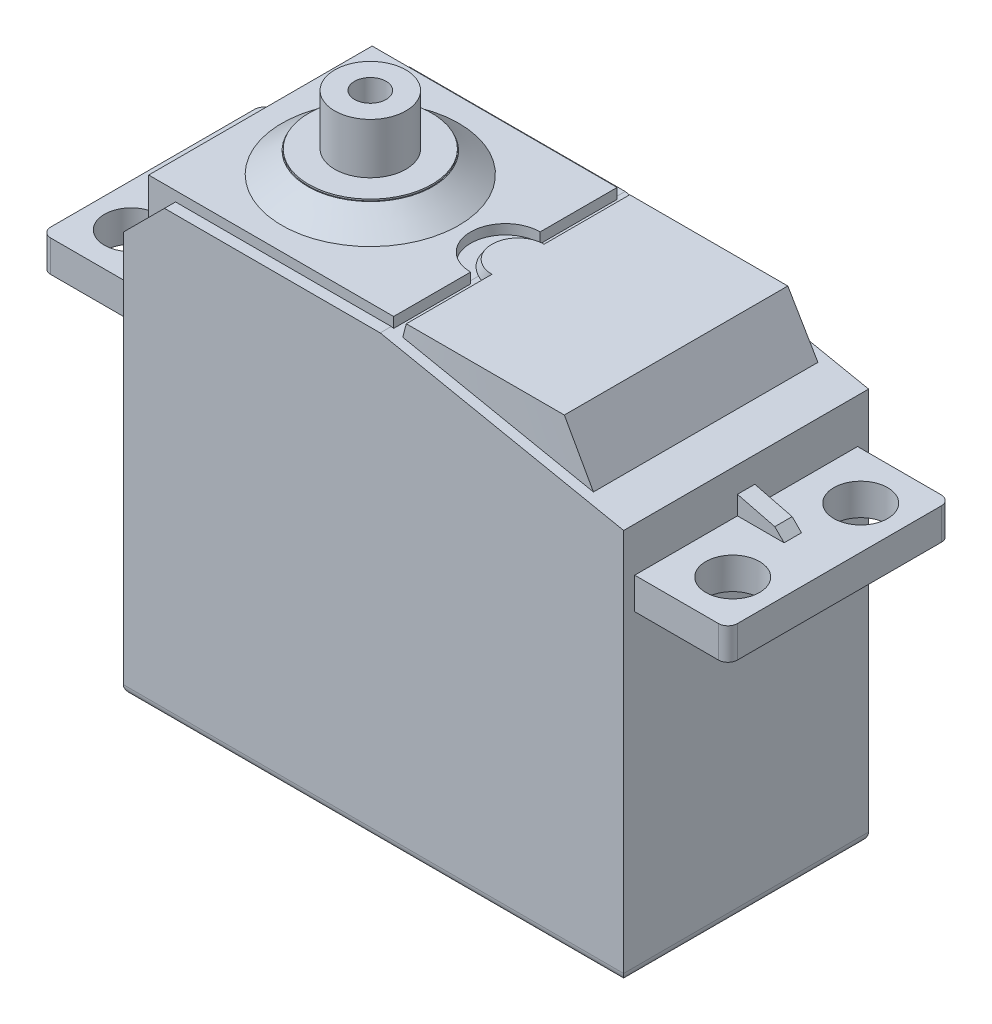
from build123d import *

# Parameters (mm, degrees)
EXTRUDE1_DEPTH     = 19.685
CHAMFER1_SIZE      = 3.302
FILLET1_R          = 0.762
SKETCH2_W          = 17.907
SKETCH2_H          = 2.54
EXTRUDE2_DEPTH     = 7.493
SKETCH4_W          = 17.907
SKETCH4_H          = 2.54
EXTRUDE3_DEPTH     = 7.493
FILLET2_R          = 0.762
EXTRUDE4_DEPTH     = 36.35375
SKETCH10_R         = 2.159
CUT_EXTRUDE1_DEPTH = 36.35375
SKETCH19_R         = 2.159
CUT_EXTRUDE2_DEPTH = 59.72110295
RIB2_START         = -0.6985
RIB2_DEPTH         = 1.397
RIB3_START         = -0.6985
RIB3_DEPTH         = 1.397
SKETCH16_R         = 5.0165
EXTRUDE5_DEPTH     = 1.651
SKETCH18_R         = 4.953
EXTRUDE6_DEPTH     = 0.127
SKETCH20_R         = 2.8575
SKETCH20_R_2       = 1.27
EXTRUDE7_DEPTH     = 4.064
SKETCH22_W         = 5.715
SKETCH22_H         = 3.175
EXTRUDE8_DEPTH     = 1.905
SKETCH24_R         = 0.635


with BuildPart() as part:
    # Sketch1 → Extrude1 (new body)
    with BuildSketch(Plane.XY):
        Polygon((0, 0), (40.2, 0), (40.2, 31.59125), (20.6375, 35.56), (0, 35.56), align=None)
    extrude(amount=EXTRUDE1_DEPTH)

    # Chamfer1
    chamfer1_edges = [part.edges().sort_by_distance(p)[0] for p in [
        (0, 35.56, 9.8425),
    ]]
    chamfer(chamfer1_edges, length=CHAMFER1_SIZE)

    # Fillet1
    fillet1_edges = [part.edges().sort_by_distance(p)[0] for p in [
        (20.1, 0, 0),
        (20.1, 0, 19.685),
        (40.2, 0, 9.8425),
        (0, 0, 9.8425),
    ]]
    fillet(fillet1_edges, radius=FILLET1_R)

    # Sketch2 → Extrude2 (add)
    with BuildSketch(Plane(origin=(40.2, 0, 0), x_dir=(0, 0, -1), z_dir=(1, 0, 0))):
        with Locations((-9.8425, 26.76525)):
            Rectangle(SKETCH2_W, SKETCH2_H)
    extrude(amount=EXTRUDE2_DEPTH)

    # Sketch4 → Extrude3 (add)
    with BuildSketch(Plane.ZY):
        with Locations((9.8425, 26.76652)):
            Rectangle(SKETCH4_W, SKETCH4_H)
    extrude(amount=EXTRUDE3_DEPTH)

    # Fillet2
    fillet2_edges = [part.edges().sort_by_distance(p)[0] for p in [
        (47.693, 26.76525, 18.796),
        (47.693, 26.76525, 0.889),
        (-7.493, 26.76652, 0.889),
        (-7.493, 26.76652, 18.796),
    ]]
    fillet(fillet2_edges, radius=FILLET2_R)

    # Sketch5 → Extrude4 (add)
    with BuildSketch(Plane(origin=(0, 0, 0), x_dir=(1, 0, 0), z_dir=(0, 1, 0))):
        with BuildLine():
            Line((1.143, -0.837535442), (20.828, -0.837535442))
            Line((20.828, -0.837535442), (20.828, -7.022435442))
            ThreePointArc((20.828, -7.022435442), (18.034, -9.816435442), (20.828, -12.610435442))
            Line((20.828, -12.610435442), (20.828, -18.795335442))
            Line((20.828, -18.795335442), (1.143, -18.795335442))
            Line((1.143, -18.795335442), (1.143, -0.837535442))
        make_face()
    extrude(amount=EXTRUDE4_DEPTH)

    # Loft1: read off the stored shape, not the designer's step
    # Loft1: loft between two sections, ruled curve by curve
    loft1_from = [
        Edge.make_bspline([(21.641638875, 35.356284925, 7.777844123), (20.350474841, 35.618230344, 7.645115734), (19.387970871, 35.813498721, 8.533256016), (19.387970871, 35.813498721, 11.181528503), (20.350474841, 35.618230344, 12.069668784), (21.641638875, 35.356284925, 11.936940395)], [0, 0, 0, 0, 0.5, 0.5, 1, 1, 1, 1], 3, [1, 0.609161307, 0.475443008, 0.475443008, 0.609161307, 1]),
        Edge.make_bspline([(21.641638875, 35.356284925, 18.877249077), (36.963924395, 32.247770131, 18.877249077)], [0, 0, 1, 1], 1),
        Edge.make_line((21.641638875, 35.356284925, 0.837535442), (36.963924395, 32.247770131, 0.837535442)),
        Edge.make_line((36.963924395, 32.247770131, 0.837535442), (36.963924395, 32.247770131, 18.877249077)),
        Edge.make_line((21.641638875, 35.356284925, 7.777844123), (21.641638875, 35.356284925, 0.837535442)),
        Edge.make_line((21.641638875, 35.356284925, 18.877249077), (21.641638875, 35.356284925, 11.936940395)),
    ]
    loft1_to = [
        Edge.make_bspline([(21.844, 36.35375, 7.720935442), (20.79625, 36.35375, 7.720935442), (19.7485, 36.35375, 8.419435442), (19.7485, 36.35375, 11.213435442), (20.79625, 36.35375, 11.911935442), (21.844, 36.35375, 11.911935442)], [0, 0, 0, 0, 0.5, 0.5, 1, 1, 1, 1], 3, [1, 0.666666667, 0.5, 0.5, 0.666666667, 1]),
        Edge.make_bspline([(21.844, 36.35375, 18.795335442), (34.544, 36.35375, 18.795335442)], [0, 0, 1, 1], 1),
        Edge.make_line((21.844, 36.35375, 0.837535442), (34.544, 36.35375, 0.837535442)),
        Edge.make_line((34.544, 36.35375, 0.837535442), (34.544, 36.35375, 18.795335442)),
        Edge.make_line((21.844, 36.35375, 7.720935442), (21.844, 36.35375, 0.837535442)),
        Edge.make_line((21.844, 36.35375, 18.795335442), (21.844, 36.35375, 11.911935442)),
    ]
    loft1 = Solid(Shell([*[Face.make_surface_from_curves(loft1_from[k], loft1_to[k]) for k in range(6)], Face(Wire(loft1_from)), Face(Wire(loft1_to))]))
    add(loft1)

    # Sketch10 → Cut-Extrude1 (cut)
    with BuildSketch(Plane(origin=(0, 28.03525, 0), x_dir=(-1, 0, 0), z_dir=(0, 1, 0))):
        with Locations(Location((-44.264, 4.699, 0), (0, 0, 90))):
            Circle(SKETCH10_R)
        with Locations(Location((-44.264, 14.986, 0), (0, 0, 90))):
            Circle(SKETCH10_R)
    extrude(amount=-CUT_EXTRUDE1_DEPTH, mode=Mode.SUBTRACT)

    # Sketch19 → Cut-Extrude2 (cut, through all)
    with BuildSketch(Plane(origin=(0, 28.03652, 0), x_dir=(-1, 0, 0), z_dir=(0, 1, 0))):
        with Locations(Location((4.064, 4.699, 0), (0, 0, 90))):
            Circle(SKETCH19_R)
        with Locations(Location((4.064, 14.986, 0), (0, 0, 90))):
            Circle(SKETCH19_R)
    extrude(amount=-CUT_EXTRUDE2_DEPTH, mode=Mode.SUBTRACT)

    # Rib2: read off the stored shape, not the designer's step
    # Rib2 outline → Rib2 (add)
    with BuildSketch(Plane.XY.offset(9.8425).offset(RIB2_START)):
        Polygon((43.95, 28.03525), (43.2, 28.78525), (40.2, 29.53525), (40.2, 28.03525), align=None)
    extrude(amount=RIB2_DEPTH)

    # Rib3: read off the stored shape, not the designer's step
    # Rib3 outline → Rib3 (add)
    with BuildSketch(Plane.XY.offset(9.8425).offset(RIB3_START)):
        Polygon((0, 29.53652), (-3, 28.78652), (-3.75, 28.03652), (0, 28.03652), align=None)
    extrude(amount=RIB3_DEPTH)

    # Sketch16 → Extrude5 (add)
    with BuildSketch(Plane(origin=(0, 36.35375, 0), x_dir=(-1, 0, 0), z_dir=(0, 1, 0))):
        with Locations(Location((-10, 9.8425, 0), (0, 0, 270))):
            Circle(SKETCH16_R)
    extrude(amount=EXTRUDE5_DEPTH)

    # Loft2: read off the stored shape, not the designer's step
    # Loft2: loft between two sections, ruled curve by curve
    loft2_from = [
        Edge.make_bspline([(10.789313033, 36.35375, 2.774435984), (-3.346815, 36.35375, 1.195809919), (-4.925441065, 36.35375, 15.331937951), (9.210686967, 36.35375, 16.910564016), (23.346815, 36.35375, 18.489190081), (24.925441065, 36.35375, 4.353062049), (10.789313033, 36.35375, 2.774435984)], [0, 0, 0, 0, 0.5, 0.5, 0.5, 1, 1, 1, 1], 3, [1, 0.333333333, 0.333333333, 1, 0.333333333, 0.333333333, 1]),
    ]
    loft2_to = [
        Edge.make_bspline([(9.493399511, 38.00475, 4.851645545), (-0.488309399, 38.00475, 5.864846522), (0.524891578, 38.00475, 15.846555433), (10.506600489, 38.00475, 14.833354455), (20.488309399, 38.00475, 13.820153478), (19.475108422, 38.00475, 3.838444567), (9.493399511, 38.00475, 4.851645545)], [0, 0, 0, 0, 0.5, 0.5, 0.5, 1, 1, 1, 1], 3, [1, 0.333333333, 0.333333333, 1, 0.333333333, 0.333333333, 1]),
    ]
    loft2 = Solid(Shell([*[Face.make_surface_from_curves(loft2_from[k], loft2_to[k]) for k in range(1)], Face(Wire(loft2_from)), Face(Wire(loft2_to))]))
    add(loft2)

    # Sketch18 → Extrude6 (add)
    with BuildSketch(Plane(origin=(0, 38.00475, 0), x_dir=(-1, 0, 0), z_dir=(0, 1, 0))):
        with Locations(Location((-10, 9.8425, 0), (0, 0, 90))):
            Circle(SKETCH18_R)
    extrude(amount=EXTRUDE6_DEPTH)

    # Sketch20 → Extrude7 (add)
    with BuildSketch(Plane(origin=(0, 38.13175, 0), x_dir=(-1, 0, 0), z_dir=(0, 1, 0))):
        with Locations(Location((-10, 9.8425, 0), (0, 0, 90))):
            Circle(SKETCH20_R)
        with Locations(Location((-10, 9.8425, 0), (0, 0, 90))):
            Circle(SKETCH20_R_2, mode=Mode.SUBTRACT)
    extrude(amount=EXTRUDE7_DEPTH)

    # Sketch22 → Extrude8 (add)
    with BuildSketch(Plane.ZY):
        with Locations((9.8425, 2.8575)):
            Rectangle(SKETCH22_W, SKETCH22_H)
    extrude(amount=EXTRUDE8_DEPTH)

    # Sketch21 → section 0 of loft3
    with BuildSketch(Plane.ZY, mode=Mode.PRIVATE) as loft3_s0:
        with BuildLine():
            Line((6.477, 4.953), (13.208, 4.953))
            Line((13.208, 4.953), (13.208, 0.762))
            Line((13.208, 0.762), (6.477, 0.762))
            Line((6.477, 0.762), (6.477, 4.953))
        make_face()
    # loft up to a face of the part (loft3)
    loft([loft3_s0.sketch, part.faces().sort_by_distance((-1.905, 2.8575, 9.8425))[0]])

    # Sweep3: sweep along a path in Sketch23
    with BuildLine(Plane.XY.offset(9.8425)) as sweep3_path:
        ThreePointArc((-1.905, 2.946484605), (-3.908218654, 2.753050744), (-5.763136487, 1.972293764))
    # Sketch24 → Sweep3 (sweep)
    with BuildSketch(Plane.ZY.offset(1.905)):
        with Locations((9.8425, 2.946484605)):
            Circle(SKETCH24_R)
        with Locations((11.23883905, 2.946484605)):
            Circle(SKETCH24_R)
        with Locations((8.466018651, 2.946484605)):
            Circle(SKETCH24_R)
    sweep(path=sweep3_path.line)


solid = part.part
